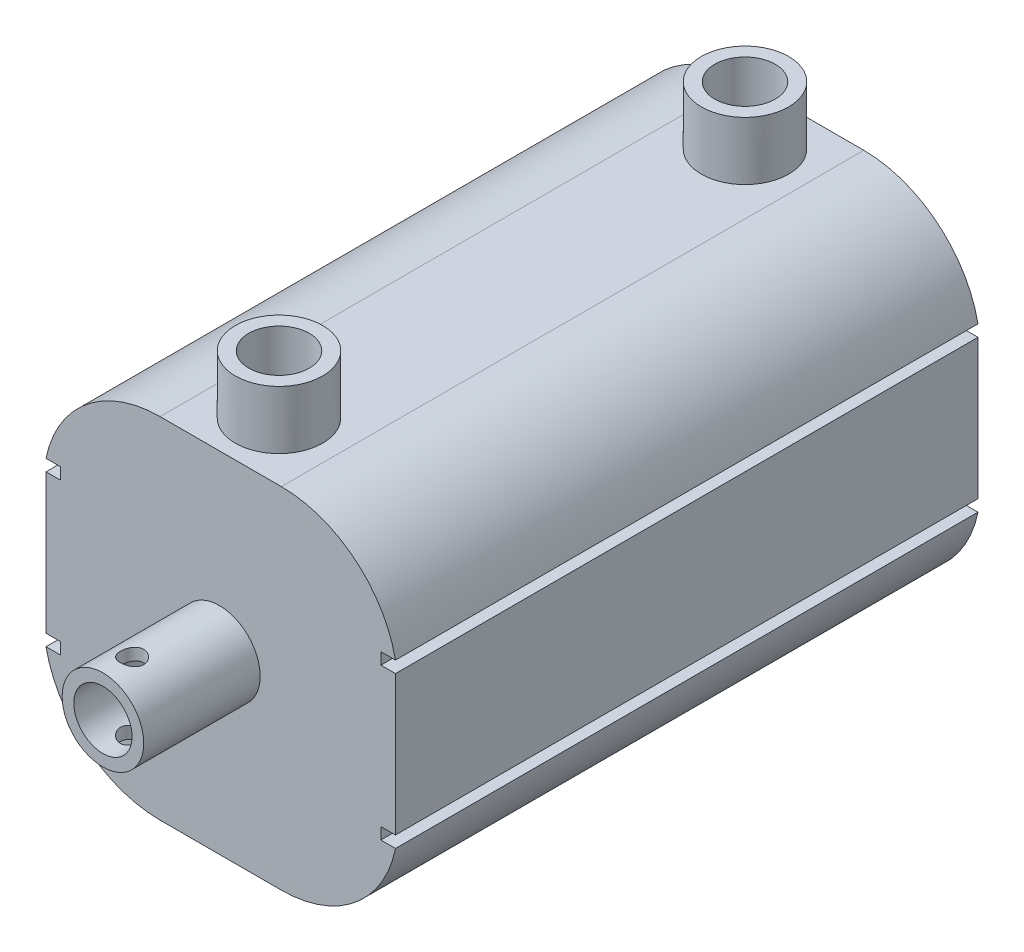
from build123d import *

# Parameters (mm, degrees)
SKETCH1_W           = 50
SKETCH1_H           = 30
BOSS_EXTRUDE1_DEPTH = 30
SKETCH3_R           = 5
CUT_EXTRUDE1_DEPTH  = 40
SKETCH4_W           = 1.254965376
SKETCH4_H           = 1
CUT_EXTRUDE2_DEPTH  = 61.207972894
SKETCH5_R           = 2.5
SKETCH5_R_2         = 2.597055459
CUT_EXTRUDE3_DEPTH  = 18
BOSS_EXTRUDE2_START = 5
SKETCH6_R           = 3.75
SKETCH6_R_2         = 2.597055459
BOSS_EXTRUDE2_DEPTH = 5
SKETCH7_R           = 2.5
CUT_EXTRUDE4_DEPTH  = 5
SKETCH8_R           = 3.5
SKETCH8_R_2         = 2.5
BOSS_EXTRUDE3_DEPTH = 10
SKETCH9_R           = 1
CUT_EXTRUDE5_DEPTH  = 56
FILLET1_R           = 10


with BuildPart() as part:
    # Sketch1 → Boss-Extrude1 (new body)
    with BuildSketch(Plane(origin=(0, 0, 0), x_dir=(0, 0, -1), z_dir=(1, 0, 0))):
        Rectangle(SKETCH1_W, SKETCH1_H)
    extrude(amount=BOSS_EXTRUDE1_DEPTH)

    # Sketch3 → Cut-Extrude1 (cut)
    with BuildSketch(Plane(origin=(0, 0, -25), x_dir=(-1, 0, 0), z_dir=(0, 0, -1))):
        with Locations((-15, 0)):
            Circle(SKETCH3_R)
    extrude(amount=-CUT_EXTRUDE1_DEPTH, mode=Mode.SUBTRACT)

    # Sketch4 → Cut-Extrude2 (cut, through all)
    with BuildSketch(Plane(origin=(0, 0, -25), x_dir=(-1, 0, 0), z_dir=(0, 0, -1))):
        with Locations((-29.372517312, 6.5)):
            Rectangle(SKETCH4_W, SKETCH4_H)
        with Locations((-29.372517312, -6.5)):
            Rectangle(SKETCH4_W, SKETCH4_H)
        with Locations((-0.627482688, -6.5)):
            Rectangle(SKETCH4_W, SKETCH4_H)
        with Locations((-0.627482688, 6.5)):
            Rectangle(SKETCH4_W, SKETCH4_H)
    extrude(amount=-CUT_EXTRUDE2_DEPTH, mode=Mode.SUBTRACT)

    # Sketch5 → Cut-Extrude3 (cut)
    with BuildSketch(Plane(origin=(0, 15, 0), x_dir=(1, 0, 0), z_dir=(0, 1, 0))):
        with Locations(Location((15, 20, 0), (0, 0, 270))):
            Circle(SKETCH5_R)
        with Locations(Location((15, -20, 0), (0, 0, 270))):
            Circle(SKETCH5_R_2)
    extrude(amount=-CUT_EXTRUDE3_DEPTH, mode=Mode.SUBTRACT)

    # Sketch6 → Boss-Extrude2 (add)
    # profile 1 of 2: a face of its own
    with BuildSketch(Plane(origin=(0, 15, 0), x_dir=(1, 0, 0), z_dir=(0, 1, 0)).offset(BOSS_EXTRUDE2_START)):
        with Locations(Location((15, -20, 0), (0, 0, 90))):
            Circle(SKETCH6_R)
        with Locations(Location((15, -20, 0), (0, 0, 270))):
            Circle(SKETCH6_R_2, mode=Mode.SUBTRACT)
    # profile 2 of 2: a face of its own
    with BuildSketch(Plane(origin=(0, 15, 0), x_dir=(1, 0, 0), z_dir=(0, 1, 0)).offset(BOSS_EXTRUDE2_START)):
        with Locations(Location((15, 20, 0), (0, 0, 90))):
            Circle(SKETCH6_R)
        with Locations(Location((15, 20, 0), (0, 0, 270))):
            Circle(SKETCH6_R_2, mode=Mode.SUBTRACT)
    extrude(amount=-BOSS_EXTRUDE2_DEPTH)

    # Sketch7 → Cut-Extrude4 (cut)
    with BuildSketch(Plane(origin=(0, 0, 15), x_dir=(-1, 0, 0), z_dir=(0, 0, -1))):
        with Locations((-15, 0)):
            Circle(SKETCH7_R)
    extrude(amount=-CUT_EXTRUDE4_DEPTH, mode=Mode.SUBTRACT)

    # Sketch8 → Boss-Extrude3 (add)
    with BuildSketch(Plane.XY.offset(25)):
        with Locations(Location((14.885614907, 0, 0), (0, 0, 180))):
            Circle(SKETCH8_R)
        with Locations((14.885614907, 0)):
            Circle(SKETCH8_R_2, mode=Mode.SUBTRACT)
    extrude(amount=BOSS_EXTRUDE3_DEPTH)

    # Sketch9 → Cut-Extrude5 (cut, through all)
    with BuildSketch(Plane(origin=(0, 15, 0), x_dir=(1, 0, 0), z_dir=(0, 1, 0))):
        with Locations(Location((14.885614907, -32.5, 0), (0, 0, 270))):
            Circle(SKETCH9_R)
    extrude(amount=-CUT_EXTRUDE5_DEPTH, mode=Mode.SUBTRACT)

    # Fillet1
    # the kernel refuses this fillet: 10 mm, written as the material it takes off along each edge
    with BuildSketch(Plane(origin=(30, -15, 49.494897428), x_dir=(-1, 0, 0), z_dir=(0, 0, -1)), Plane(origin=(30, 15, -49.494897428), x_dir=(-1, 0, 0), z_dir=(0, 0, 1))) as fillet1_piece_1:
        with BuildLine():
            CenterArc((9.797958971, 10), FILLET1_R, 191.536959033, 78.463040967)
            Line((0, 8), (-0.195959179, 7.96))
            ThreePointArc((-0.195959179, 7.96), (-0.2, 4), (-0.2, 0))
            Line((-0.2, 0), (0, -0.2))
            Line((0, -0.2), (9.797958971, -0.2))
            Line((9.797958971, -0.2), (9.797958971, 0))
        make_face()
    extrude(amount=98.989794856, mode=Mode.SUBTRACT)
    with BuildSketch(Plane(origin=(0, -15, 49.494897428), x_dir=(1, 0, 0), z_dir=(0, 0, -1))) as fillet1_piece_2:
        with BuildLine():
            CenterArc((9.797958971, -10), FILLET1_R, 90, 78.463040967)
            Line((0, -8), (-0.195959179, -7.96))
            ThreePointArc((-0.195959179, -7.96), (-0.2, -4), (-0.2, 0))
            Line((-0.2, 0), (0, 0.2))
            Line((0, 0.2), (9.797958971, 0.2))
            Line((9.797958971, 0.2), (9.797958971, 0))
        make_face()
    extrude(amount=98.989794856, mode=Mode.SUBTRACT)
    with BuildSketch(Plane(origin=(0, 15, -49.494897428), x_dir=(0, -1, 0), z_dir=(0, 0, 1))) as fillet1_piece_3:
        with BuildLine():
            CenterArc((10, 9.797958971), FILLET1_R, 180, 78.463040967)
            Line((0, 9.797958971), (-0.2, 9.797958971))
            Line((-0.2, 9.797958971), (-0.2, 0))
            Line((-0.2, 0), (0, -0.2))
            ThreePointArc((0, -0.2), (4, -0.2), (7.96, -0.195959179))
            Line((7.96, -0.195959179), (8, 0))
        make_face()
    extrude(amount=98.989794856, mode=Mode.SUBTRACT)


solid = part.part
